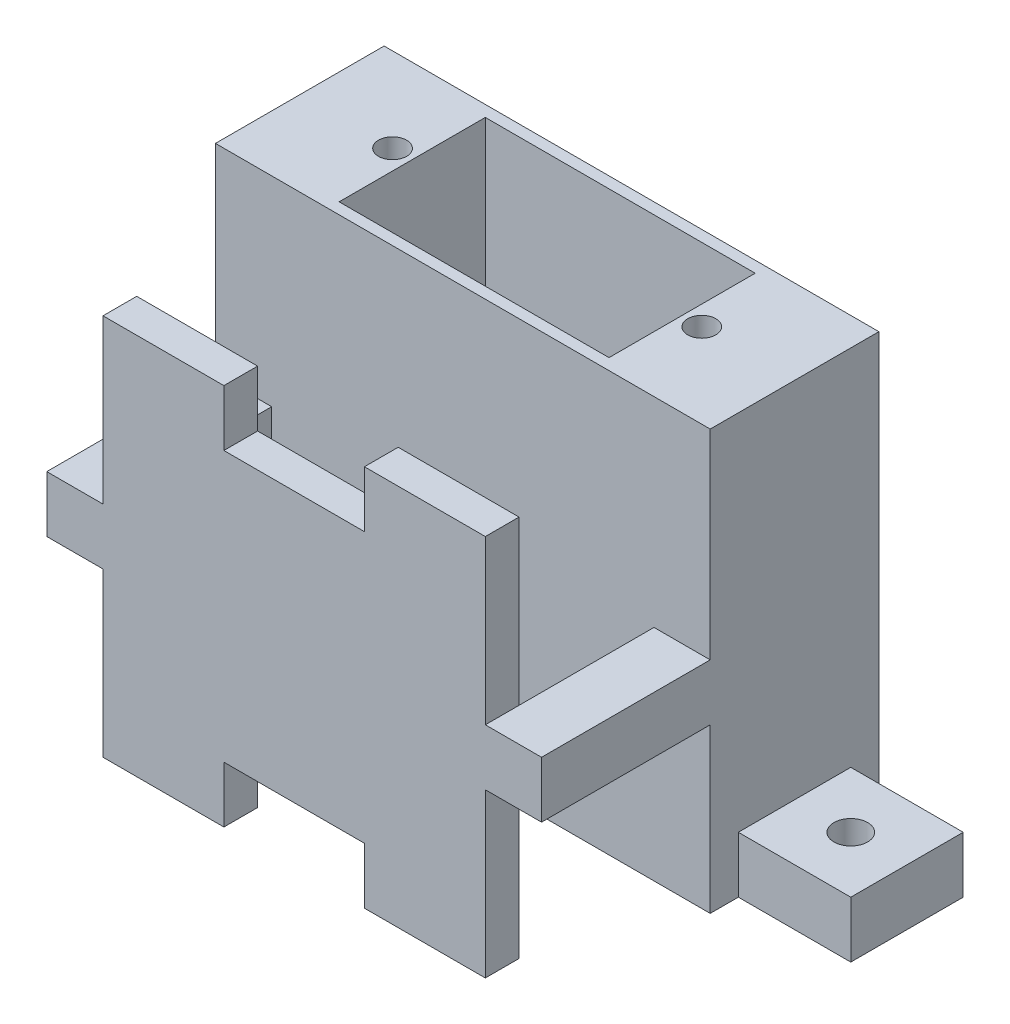
from build123d import *

# Parameters (mm, degrees)
SKETCH1_W           = 34
SKETCH1_H           = 34
BOSS_EXTRUDE1_DEPTH = 3
SKETCH2_W           = 12.5
SKETCH2_H           = 5
CUT_EXTRUDE1_DEPTH  = 49.176757882
BOSS_EXTRUDE2_DEPTH = 5
SKETCH33_W          = 15
SKETCH33_H          = 5
BOSS_EXTRUDE4_DEPTH = 5
BOSS_EXTRUDE6_DEPTH = 15
SKETCH36_W          = 24
SKETCH36_H          = 13
CUT_EXTRUDE2_DEPTH  = 19.5
SKETCH38_W          = 10
SKETCH38_H          = 10
BOSS_EXTRUDE7_DEPTH = 5
SKETCH39_R          = 1.5
CUT_EXTRUDE3_DEPTH  = 65.602833129
SKETCH40_R          = 1.25
CUT_EXTRUDE4_DEPTH  = 5


with BuildPart() as part:
    # Sketch1 → Boss-Extrude1 (new body)
    with BuildSketch(Plane.XY):
        with Locations((17, -17)):
            Rectangle(SKETCH1_W, SKETCH1_H)
    extrude(amount=BOSS_EXTRUDE1_DEPTH)

    # Sketch2 → Cut-Extrude1 (cut, through all)
    with BuildSketch(Plane(origin=(0, 0, 0), x_dir=(-1, 0, 0), z_dir=(0, 0, -1))):
        with Locations((-17, -2.5)):
            Rectangle(SKETCH2_W, SKETCH2_H)
        with Locations((-17, -31.5)):
            Rectangle(SKETCH2_W, SKETCH2_H)
    extrude(amount=-CUT_EXTRUDE1_DEPTH, mode=Mode.SUBTRACT)

    # Sketch25 → Boss-Extrude2 (add)
    with BuildSketch(Plane(origin=(34, 0, 0), x_dir=(0, 0, -1), z_dir=(1, 0, 0))):
        Polygon((-3, -17), (-3, -14.5), (12, -14.5), (12, -19.5), (-3, -19.5), align=None)
    extrude(amount=BOSS_EXTRUDE2_DEPTH)

    # Sketch33 → Boss-Extrude4 (add)
    with BuildSketch(Plane.ZY):
        with Locations((-4.5, -17)):
            Rectangle(SKETCH33_W, SKETCH33_H)
    extrude(amount=BOSS_EXTRUDE4_DEPTH)

    # Sketch35 → Boss-Extrude6 (add)
    with BuildSketch(Plane(origin=(0, 0, -12), x_dir=(-1, 0, 0), z_dir=(0, 0, -1))):
        Polygon((-39, -17), (-39, 3.277699473), (5, 3.277699473), (5, -17), (5, -34.025954319), (-39, -34.025954319), align=None)
    extrude(amount=BOSS_EXTRUDE6_DEPTH)

    # Sketch36 → Cut-Extrude2 (cut)
    with BuildSketch(Plane(origin=(0, 3.277699473, 0), x_dir=(1, 0, 0), z_dir=(0, 1, 0))):
        with Locations((17, 19.5)):
            Rectangle(SKETCH36_W, SKETCH36_H)
    extrude(amount=-CUT_EXTRUDE2_DEPTH, mode=Mode.SUBTRACT)

    # Sketch38 → Boss-Extrude7 (add)
    with BuildSketch(Plane(origin=(0, -34.025954319, 0), x_dir=(-1, 0, 0), z_dir=(0, -1, 0))):
        with Locations((-44, 19.5)):
            Rectangle(SKETCH38_W, SKETCH38_H)
        with Locations((10, 19.5)):
            Rectangle(SKETCH38_W, SKETCH38_H)
    extrude(amount=-BOSS_EXTRUDE7_DEPTH)

    # Sketch39 → Cut-Extrude3 (cut, through all)
    with BuildSketch(Plane(origin=(0, -29.025954319, 0), x_dir=(1, 0, 0), z_dir=(0, 1, 0))):
        with Locations((-10, 19.5)):
            Circle(SKETCH39_R)
        with Locations((44, 19.5)):
            Circle(SKETCH39_R)
    extrude(amount=-CUT_EXTRUDE3_DEPTH, mode=Mode.SUBTRACT)

    # Sketch40 → Cut-Extrude4 (cut)
    with BuildSketch(Plane(origin=(0, 3.277699473, 0), x_dir=(1, 0, 0), z_dir=(0, 1, 0))):
        with Locations((3.25, 19.5)):
            Circle(SKETCH40_R)
        with Locations((30.75, 19.5)):
            Circle(SKETCH40_R)
    extrude(amount=-CUT_EXTRUDE4_DEPTH, mode=Mode.SUBTRACT)


solid = part.part
